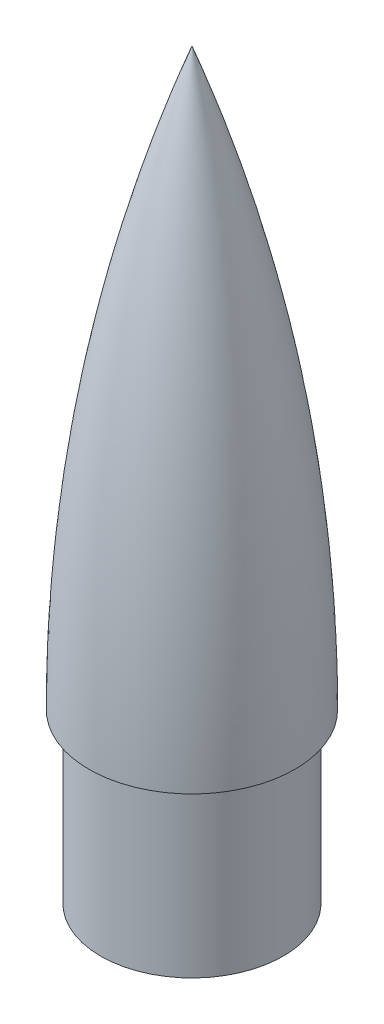
from build123d import *

# Parameters (mm, degrees)
BOSS_EXTRUDE2_DEPTH = 70
FILLET1_R           = 1
SHELL1_T            = -2
BOSS_EXTRUDE6_DEPTH = 69


with BuildPart() as part:
    # Sketch1 → Cone (revolve)
    with BuildSketch(Plane.XY):
        with BuildLine():
            Line((-38.1, 0), (-34.1, 0))
            Line((-34.1, 0), (-34.1, 151.921980751))
            ThreePointArc((-34.1, 151.921980751), (-21.059320769, 226.007119932), (0, 298.223268895))
            Line((0, 298.223268895), (0, 310))
            ThreePointArc((0, 310), (-32.165086886, 191.910828067), (-43, 70))
            Line((-43, 70), (-38.1, 70))
            Line((-38.1, 70), (-38.1, 0))
        make_face()
    revolve(axis=Axis((0, -0.943273363, 0), (0, 1, 0)))


with BuildPart() as body_2:
    # Sketch4 → Boss-Extrude2 (new body)
    with BuildSketch(Plane.XZ):
        with BuildLine():
            Line((15, 15.1), (-15, 15.1))
            Line((-15, 15.1), (-15, 30.623683645))
            ThreePointArc((-15, 30.623683645), (0, -34.1), (15, 30.623683645))
            Line((15, 30.623683645), (15, 15.1))
        make_face()
    extrude(amount=-BOSS_EXTRUDE2_DEPTH)

    # Fillet1
    fillet1_edges = [body_2.edges().sort_by_distance(p)[0] for p in [
        (-15, 35, 15.1),
        (15, 35, 15.1),
    ]]
    fillet(fillet1_edges, radius=FILLET1_R)

    # Shell1
    shell1_openings = [body_2.faces().sort_by_distance(p)[0] for p in [
        (0, 0, -4.134823926),
        (0, 70, -4.134823926),
    ]]
    offset(amount=SHELL1_T, openings=shell1_openings, kind=Kind.INTERSECTION)

    # Sketch5 → Boss-Extrude6 (add)
    with BuildSketch(Plane(origin=(0, 70, 0), x_dir=(1, 0, 0), z_dir=(0, 1, 0))):
        Polygon((-29.305289625, -13.1), (29.305289625, -13.1), (31.245230426, -11.1), (-31.496536191, -11.1), align=None)
    extrude(amount=-BOSS_EXTRUDE6_DEPTH)


solid = Compound([part.part, body_2.part])
